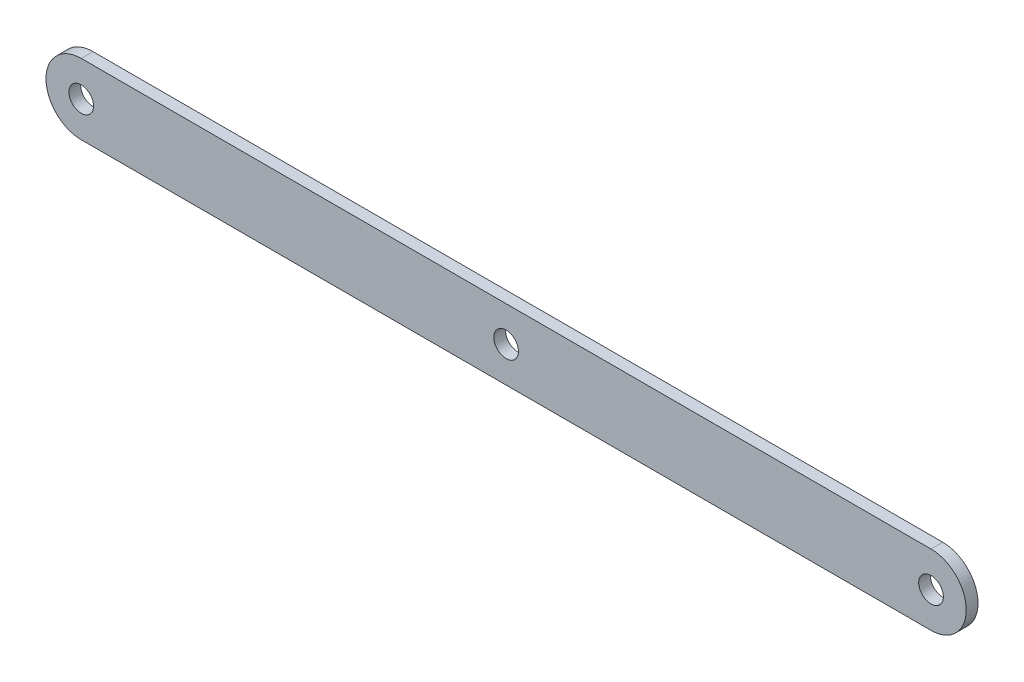
from build123d import *

# Parameters (mm, degrees)
SKIZZE2_R                       = 2.1
AUFSATZ_LINEAR_AUSTRAGEN1_DEPTH = 2


with BuildPart() as part:
    # Skizze2 → Aufsatz-Linear austragen1 (new body)
    with BuildSketch(Plane.XY):
        with BuildLine():
            Line((-72.34, 6), (72.34, 6))
            ThreePointArc((72.34, 6), (78.34, 0), (72.34, -6))
            Line((72.34, -6), (-72.34, -6))
            ThreePointArc((-72.34, -6), (-78.34, 0), (-72.34, 6))
        make_face()
        with Locations((-72.34, 0)):
            Circle(SKIZZE2_R, mode=Mode.SUBTRACT)
        with Locations((72.34, 0)):
            Circle(SKIZZE2_R, mode=Mode.SUBTRACT)
        Circle(SKIZZE2_R, mode=Mode.SUBTRACT)
    extrude(amount=AUFSATZ_LINEAR_AUSTRAGEN1_DEPTH)


solid = part.part
